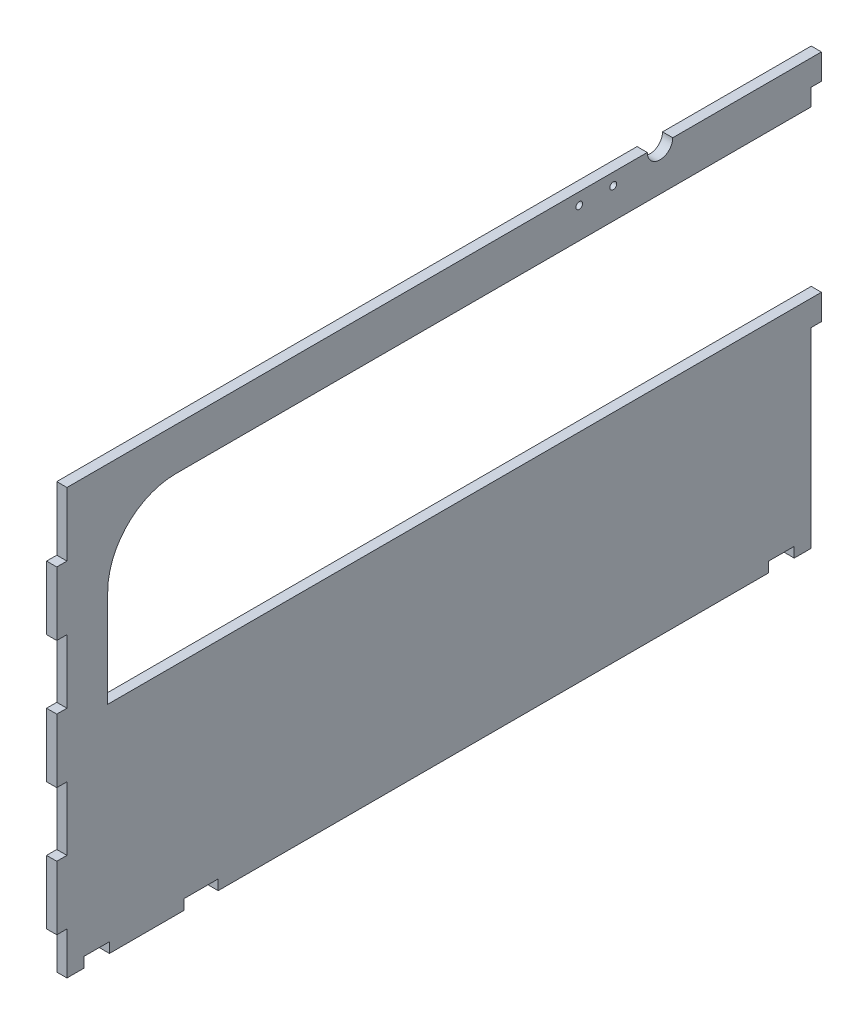
from build123d import *

# Parameters (mm, degrees)
BOSS_EXTRUDE1_DEPTH = 6
SKETCH2_W           = 6
SKETCH2_H           = 37.5
CUT_EXTRUDE1_DEPTH  = 6
LPATTERN1_COUNT     = 4
LPATTERN1_PITCH     = 75
FILLET1_R           = 40
SKETCH3_W           = 6
SKETCH3_H           = 10
SKETCH3_H_2         = 112.5
CUT_EXTRUDE2_DEPTH  = 515.816472153
SKETCH4_W           = 15
SKETCH4_H           = 6
CUT_EXTRUDE3_DEPTH  = 515.816472153
SKETCH5_R           = 2
CUT_EXTRUDE4_DEPTH  = 515.816472153
SKETCH6_W           = 20
SKETCH6_H           = 6
CUT_EXTRUDE5_DEPTH  = 515.816472153


with BuildPart() as part:
    # Sketch1 → Boss-Extrude1 (new body)
    with BuildSketch(Plane(origin=(0, 0, 0), x_dir=(0, 0, -1), z_dir=(1, 0, 0))):
        Polygon((450, 225), (450, 250), (0, 250), (0, 0), (450, 0), (450, 127.5), (30, 127.5), (30, 225), align=None)
    extrude(amount=BOSS_EXTRUDE1_DEPTH)

    # Sketch2 → Cut-Extrude1 (cut)
    with BuildSketch(Plane(origin=(6, 0, 0), x_dir=(0, 0, -1), z_dir=(1, 0, 0))):
        with Locations((3, 231.25)):
            Rectangle(SKETCH2_W, SKETCH2_H)
    cut_extrude1 = extrude(amount=-CUT_EXTRUDE1_DEPTH, mode=Mode.SUBTRACT)

    # LPattern1: Cut-Extrude1 ×4
    with Locations(*[(0, -i * LPATTERN1_PITCH, 0) for i in range(1, LPATTERN1_COUNT)]):
        add(cut_extrude1, mode=Mode.SUBTRACT)

    # Fillet1
    fillet1_edges = [part.edges().sort_by_distance(p)[0] for p in [
        (3, 225, -30),
    ]]
    fillet(fillet1_edges, radius=FILLET1_R)

    # Sketch3 → Cut-Extrude2 (cut, through all)
    with BuildSketch(Plane.ZY):
        with Locations((-447, 230)):
            Rectangle(SKETCH3_W, SKETCH3_H)
        with Locations((-447, 56.25)):
            Rectangle(SKETCH3_W, SKETCH3_H_2)
    extrude(amount=-CUT_EXTRUDE2_DEPTH, mode=Mode.SUBTRACT)

    # Sketch4 → Cut-Extrude3 (cut, through all)
    with BuildSketch(Plane.ZY):
        with Locations((-23.5, 3)):
            Rectangle(SKETCH4_W, SKETCH4_H)
        with Locations((-426.5, 3)):
            Rectangle(SKETCH4_W, SKETCH4_H)
    extrude(amount=-CUT_EXTRUDE3_DEPTH, mode=Mode.SUBTRACT)

    # Sketch5 → Cut-Extrude4 (cut, through all)
    with BuildSketch(Plane.ZY):
        with Locations((-327.5, 243)):
            Circle(SKETCH5_R)
        with Locations((-307.5, 243)):
            Circle(SKETCH5_R)
        with BuildLine():
            Line((-362.5, 250), (-347.5, 250))
            ThreePointArc((-347.5, 250), (-355, 242.5), (-362.5, 250))
        make_face()
    extrude(amount=-CUT_EXTRUDE4_DEPTH, mode=Mode.SUBTRACT)

    # Sketch6 → Cut-Extrude5 (cut, through all)
    with BuildSketch(Plane.ZY):
        with Locations((-85, 3)):
            Rectangle(SKETCH6_W, SKETCH6_H)
    extrude(amount=-CUT_EXTRUDE5_DEPTH, mode=Mode.SUBTRACT)


solid = part.part
